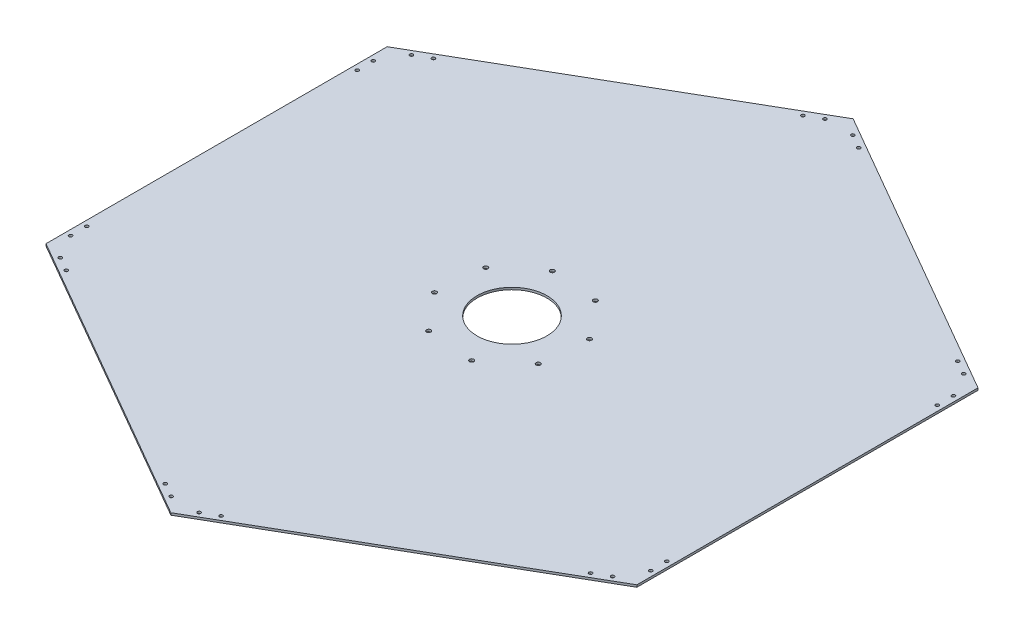
from build123d import *

# Parameters (mm, degrees)
BOSS_EXTRUDE1_DEPTH = 4
CUT_EXTRUDE1_REACH  = 842.148
SKETCH3_R           = 4
CUT_EXTRUDE2_REACH  = 842.148
SKETCH4_R           = 3.1
CIRPATTERN1_COUNT   = 6
CUT_EXTRUDE3_REACH  = 842.148
SKETCH5_R           = 65


with BuildPart() as part:
    # Sketch1 → Boss-Extrude1 (new body)
    with BuildSketch(Plane(origin=(0, 0, 0), x_dir=(1, 0, 0), z_dir=(0, 1, 0))):
        Polygon((0, 635.085296109), (-550, 317.542648054), (-550, -317.542648054), (0, -635.085296109), (550, -317.542648054), (550, 317.542648054), align=None)
    extrude(amount=BOSS_EXTRUDE1_DEPTH)

    # Sketch3 → Cut-Extrude1 (cut, up to next)
    with BuildSketch(Plane(origin=(0, 4, 0), x_dir=(1, 0, 0), z_dir=(0, 1, 0)), mode=Mode.PRIVATE) as cut_extrude1_sk1:
        with Locations((53.101090522, 102.006245815)):
            Circle(SKETCH3_R)
    cut_extrude1_tool1 = extrude(cut_extrude1_sk1.sketch, amount=-CUT_EXTRUDE1_REACH, mode=Mode.PRIVATE) & part.part
    # Sketch3 → Cut-Extrude1 (cut, up to next)
    with BuildSketch(Plane(origin=(0, 4, 0), x_dir=(1, 0, 0), z_dir=(0, 1, 0)), mode=Mode.PRIVATE) as cut_extrude1_sk2:
        with Locations((109.677449336, 34.581166943)):
            Circle(SKETCH3_R)
    cut_extrude1_tool2 = extrude(cut_extrude1_sk2.sketch, amount=-CUT_EXTRUDE1_REACH, mode=Mode.PRIVATE) & part.part
    # Sketch3 → Cut-Extrude1 (cut, up to next)
    with BuildSketch(Plane(origin=(0, 4, 0), x_dir=(1, 0, 0), z_dir=(0, 1, 0)), mode=Mode.PRIVATE) as cut_extrude1_sk3:
        with Locations((102.006245815, -53.101090522)):
            Circle(SKETCH3_R)
    cut_extrude1_tool3 = extrude(cut_extrude1_sk3.sketch, amount=-CUT_EXTRUDE1_REACH, mode=Mode.PRIVATE) & part.part
    # Sketch3 → Cut-Extrude1 (cut, up to next)
    with BuildSketch(Plane(origin=(0, 4, 0), x_dir=(1, 0, 0), z_dir=(0, 1, 0)), mode=Mode.PRIVATE) as cut_extrude1_sk4:
        with Locations((34.581166943, -109.677449336)):
            Circle(SKETCH3_R)
    cut_extrude1_tool4 = extrude(cut_extrude1_sk4.sketch, amount=-CUT_EXTRUDE1_REACH, mode=Mode.PRIVATE) & part.part
    # Sketch3 → Cut-Extrude1 (cut, up to next)
    with BuildSketch(Plane(origin=(0, 4, 0), x_dir=(1, 0, 0), z_dir=(0, 1, 0)), mode=Mode.PRIVATE) as cut_extrude1_sk5:
        with Locations((-53.101090522, -102.006245815)):
            Circle(SKETCH3_R)
    cut_extrude1_tool5 = extrude(cut_extrude1_sk5.sketch, amount=-CUT_EXTRUDE1_REACH, mode=Mode.PRIVATE) & part.part
    # Sketch3 → Cut-Extrude1 (cut, up to next)
    with BuildSketch(Plane(origin=(0, 4, 0), x_dir=(1, 0, 0), z_dir=(0, 1, 0)), mode=Mode.PRIVATE) as cut_extrude1_sk6:
        with Locations((-109.677449336, -34.581166943)):
            Circle(SKETCH3_R)
    cut_extrude1_tool6 = extrude(cut_extrude1_sk6.sketch, amount=-CUT_EXTRUDE1_REACH, mode=Mode.PRIVATE) & part.part
    # Sketch3 → Cut-Extrude1 (cut, up to next)
    with BuildSketch(Plane(origin=(0, 4, 0), x_dir=(1, 0, 0), z_dir=(0, 1, 0)), mode=Mode.PRIVATE) as cut_extrude1_sk7:
        with Locations((-102.006245815, 53.101090522)):
            Circle(SKETCH3_R)
    cut_extrude1_tool7 = extrude(cut_extrude1_sk7.sketch, amount=-CUT_EXTRUDE1_REACH, mode=Mode.PRIVATE) & part.part
    # Sketch3 → Cut-Extrude1 (cut, up to next)
    with BuildSketch(Plane(origin=(0, 4, 0), x_dir=(1, 0, 0), z_dir=(0, 1, 0)), mode=Mode.PRIVATE) as cut_extrude1_sk8:
        with Locations((-34.581166943, 109.677449336)):
            Circle(SKETCH3_R)
    cut_extrude1_tool8 = extrude(cut_extrude1_sk8.sketch, amount=-CUT_EXTRUDE1_REACH, mode=Mode.PRIVATE) & part.part
    add(cut_extrude1_tool1.solids().sort_by_distance((53.101091, 4, -102.006246))[0], mode=Mode.SUBTRACT)
    add(cut_extrude1_tool2.solids().sort_by_distance((109.677449, 4, -34.581167))[0], mode=Mode.SUBTRACT)
    add(cut_extrude1_tool3.solids().sort_by_distance((102.006246, 4, 53.101091))[0], mode=Mode.SUBTRACT)
    add(cut_extrude1_tool4.solids().sort_by_distance((34.581167, 4, 109.677449))[0], mode=Mode.SUBTRACT)
    add(cut_extrude1_tool5.solids().sort_by_distance((-53.101091, 4, 102.006246))[0], mode=Mode.SUBTRACT)
    add(cut_extrude1_tool6.solids().sort_by_distance((-109.677449, 4, 34.581167))[0], mode=Mode.SUBTRACT)
    add(cut_extrude1_tool7.solids().sort_by_distance((-102.006246, 4, -53.101091))[0], mode=Mode.SUBTRACT)
    add(cut_extrude1_tool8.solids().sort_by_distance((-34.581167, 4, -109.677449))[0], mode=Mode.SUBTRACT)

    # Sketch4 → Cut-Extrude2 (cut, up to next)
    with BuildSketch(Plane(origin=(0, 4, 0), x_dir=(1, 0, 0), z_dir=(0, 1, 0)), mode=Mode.PRIVATE) as cut_extrude2_sk1:
        with Locations((25.980762114, 608.538290725)):
            Circle(SKETCH4_R)
    cut_extrude2_tool1 = extrude(cut_extrude2_sk1.sketch, amount=-CUT_EXTRUDE2_REACH, mode=Mode.PRIVATE) & part.part
    # Sketch4 → Cut-Extrude2 (cut, up to next)
    with BuildSketch(Plane(origin=(0, 4, 0), x_dir=(1, 0, 0), z_dir=(0, 1, 0)), mode=Mode.PRIVATE) as cut_extrude2_sk2:
        with Locations((51.961524227, 593.538290725)):
            Circle(SKETCH4_R)
    cut_extrude2_tool2 = extrude(cut_extrude2_sk2.sketch, amount=-CUT_EXTRUDE2_REACH, mode=Mode.PRIVATE) & part.part
    # Sketch4 → Cut-Extrude2 (cut, up to next)
    with BuildSketch(Plane(origin=(0, 4, 0), x_dir=(1, 0, 0), z_dir=(0, 1, 0)), mode=Mode.PRIVATE) as cut_extrude2_sk3:
        with Locations((-51.961524227, 593.538290725)):
            Circle(SKETCH4_R)
    cut_extrude2_tool3 = extrude(cut_extrude2_sk3.sketch, amount=-CUT_EXTRUDE2_REACH, mode=Mode.PRIVATE) & part.part
    # Sketch4 → Cut-Extrude2 (cut, up to next)
    with BuildSketch(Plane(origin=(0, 4, 0), x_dir=(1, 0, 0), z_dir=(0, 1, 0)), mode=Mode.PRIVATE) as cut_extrude2_sk4:
        with Locations((-25.980762114, 608.538290725)):
            Circle(SKETCH4_R)
    cut_extrude2_tool4 = extrude(cut_extrude2_sk4.sketch, amount=-CUT_EXTRUDE2_REACH, mode=Mode.PRIVATE) & part.part
    cut_extrude2_1 = cut_extrude2_tool1.solids().sort_by_distance((25.980762, 4, -608.538291))[0]
    add(cut_extrude2_1, mode=Mode.SUBTRACT)
    cut_extrude2_2 = cut_extrude2_tool2.solids().sort_by_distance((51.961524, 4, -593.538291))[0]
    add(cut_extrude2_2, mode=Mode.SUBTRACT)
    cut_extrude2_3 = cut_extrude2_tool3.solids().sort_by_distance((-51.961524, 4, -593.538291))[0]
    add(cut_extrude2_3, mode=Mode.SUBTRACT)
    cut_extrude2_4 = cut_extrude2_tool4.solids().sort_by_distance((-25.980762, 4, -608.538291))[0]
    add(cut_extrude2_4, mode=Mode.SUBTRACT)
    cut_extrude2 = cut_extrude2_1 + cut_extrude2_2 + cut_extrude2_3 + cut_extrude2_4  # Cut-Extrude2 as one shape, for the pattern or mirror that repeats it

    # CirPattern1: Cut-Extrude2 ×6 about axis
    cirpattern1_axis = Axis((0, 4.2, 0), (0, -1, 0))
    for i in range(1, CIRPATTERN1_COUNT):
        add(cut_extrude2.rotate(cirpattern1_axis, i * 360 / CIRPATTERN1_COUNT), mode=Mode.SUBTRACT)

    # Sketch5 → Cut-Extrude3 (cut, up to next)
    with BuildSketch(Plane(origin=(0, 4, 0), x_dir=(1, 0, 0), z_dir=(0, 1, 0)), mode=Mode.PRIVATE) as cut_extrude3_sk1:
        Circle(SKETCH5_R)
    cut_extrude3_tool1 = extrude(cut_extrude3_sk1.sketch, amount=-CUT_EXTRUDE3_REACH, mode=Mode.PRIVATE) & part.part
    add(cut_extrude3_tool1.solids().sort_by_distance((0, 4, 0))[0], mode=Mode.SUBTRACT)


solid = part.part
